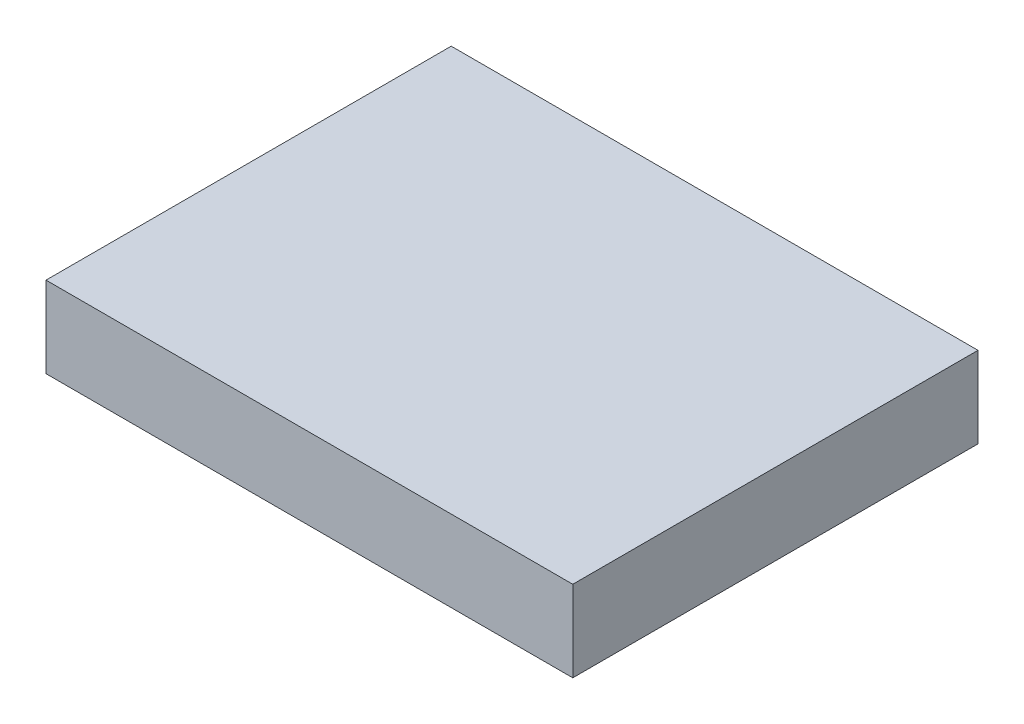
from build123d import *

# Parameters (mm, degrees)
SKETCH1_W           = 330.2
SKETCH1_H           = 254
BOSS_EXTRUDE1_DEPTH = 50.8


with BuildPart() as part:
    # Sketch1 → Boss-Extrude1 (new body)
    with BuildSketch(Plane(origin=(0, 0, 0), x_dir=(1, 0, 0), z_dir=(0, 1, 0))):
        with Locations((165.1, 127)):
            Rectangle(SKETCH1_W, SKETCH1_H)
    extrude(amount=BOSS_EXTRUDE1_DEPTH)


solid = part.part
